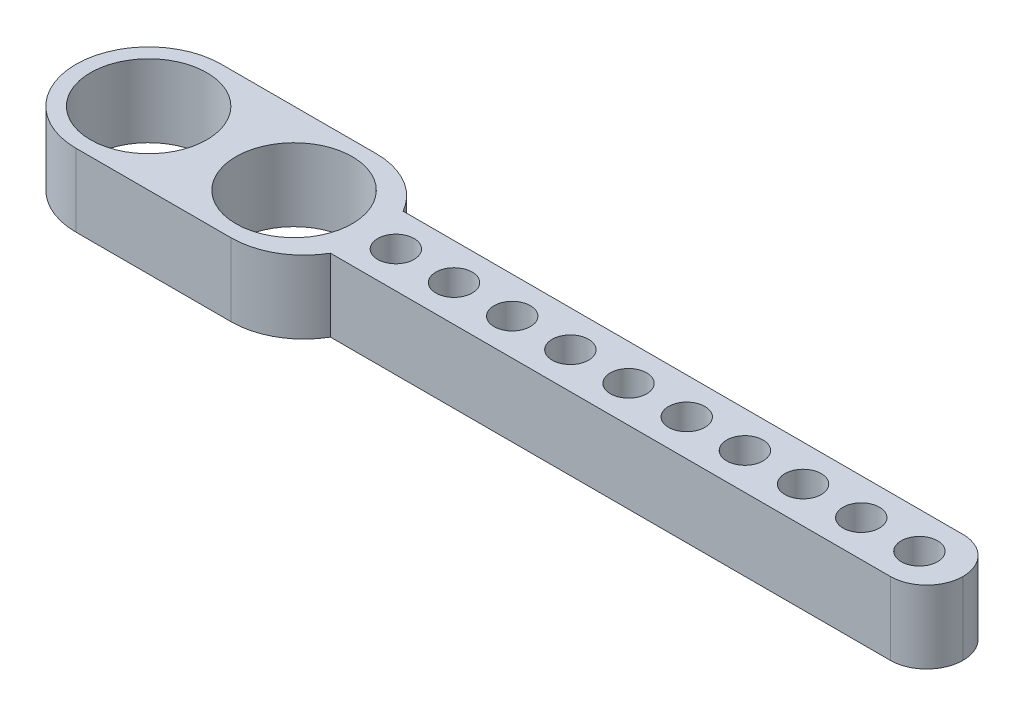
from build123d import *

# Parameters (mm, degrees)
SKETCH1_W           = 25.4
SKETCH1_H           = 12.7
SKETCH1_R           = 5.08
SKETCH1_W_2         = 52.07
SKETCH1_H_2         = 6.35
SKETCH1_R_2         = 1.5875
BOSS_EXTRUDE1_DEPTH = 6.35
FILLET1_R           = 6.35
FILLET2_R           = 3.175


# Some blends are built 0.0001 mm under size
with BuildPart() as part:
    # Sketch1 → Boss-Extrude1 (new body)
    # profile 1 of 2: a face of its own
    with BuildSketch(Plane(origin=(0, 0, 0), x_dir=(1, 0, 0), z_dir=(0, 1, 0))):
        with Locations((12.7, 6.35)):
            Rectangle(SKETCH1_W, SKETCH1_H)
        with Locations(Location((19.05, 6.35, 0), (0, 0, 270))):
            Circle(SKETCH1_R, mode=Mode.SUBTRACT)
        with Locations(Location((6.35, 6.35, 0), (0, 0, 270))):
            Circle(SKETCH1_R, mode=Mode.SUBTRACT)
    # profile 2 of 2: a face of its own
    with BuildSketch(Plane(origin=(0, 0, 0), x_dir=(1, 0, 0), z_dir=(0, 1, 0))):
        with Locations((51.435, 6.35)):
            Rectangle(SKETCH1_W_2, SKETCH1_H_2)
        with Locations(Location((27.94, 6.35, 0), (0, 0, 270))):
            Circle(SKETCH1_R_2, mode=Mode.SUBTRACT)
        with Locations(Location((33.02, 6.35, 0), (0, 0, 270))):
            Circle(SKETCH1_R_2, mode=Mode.SUBTRACT)
        with Locations(Location((38.1, 6.35, 0), (0, 0, 270))):
            Circle(SKETCH1_R_2, mode=Mode.SUBTRACT)
        with Locations(Location((43.18, 6.35, 0), (0, 0, 270))):
            Circle(SKETCH1_R_2, mode=Mode.SUBTRACT)
        with Locations(Location((48.26, 6.35, 0), (0, 0, 270))):
            Circle(SKETCH1_R_2, mode=Mode.SUBTRACT)
        with Locations(Location((53.34, 6.35, 0), (0, 0, 270))):
            Circle(SKETCH1_R_2, mode=Mode.SUBTRACT)
        with Locations(Location((58.42, 6.35, 0), (0, 0, 270))):
            Circle(SKETCH1_R_2, mode=Mode.SUBTRACT)
        with Locations(Location((63.5, 6.35, 0), (0, 0, 270))):
            Circle(SKETCH1_R_2, mode=Mode.SUBTRACT)
        with Locations(Location((68.58, 6.35, 0), (0, 0, 270))):
            Circle(SKETCH1_R_2, mode=Mode.SUBTRACT)
        with Locations(Location((73.66, 6.35, 0), (0, 0, 270))):
            Circle(SKETCH1_R_2, mode=Mode.SUBTRACT)
    extrude(amount=BOSS_EXTRUDE1_DEPTH)

    # Fillet1
    # the kernel refuses this fillet: 6.35 mm, written as the material it takes off along each edge
    with BuildSketch(Plane(origin=(25.4, -13.748153285, -12.7), x_dir=(-1, 0, 0), z_dir=(0, 1, 0))) as fillet1_piece_1:
        with BuildLine():
            CenterArc((5.499261314, 6.35), FILLET1_R, 210, 60)
            Line((0, 3.175), (-0.109985226, 3.1115))
            ThreePointArc((-0.109985226, 3.1115), (-0.127, 1.5875), (-0.127, 0))
            Line((-0.127, 0), (0, -0.127))
            Line((0, -0.127), (5.499261314, -0.127))
            Line((5.499261314, -0.127), (5.499261314, 0))
        make_face()
    extrude(amount=33.84630657, mode=Mode.SUBTRACT)
    with BuildSketch(Plane(origin=(25.4, -13.748153285, 0), x_dir=(-1, 0, 0), z_dir=(0, 1, 0))) as fillet1_piece_2:
        with BuildLine():
            CenterArc((5.499261314, -6.35), FILLET1_R, 90, 60)
            Line((0, -3.175), (-0.109985226, -3.1115))
            ThreePointArc((-0.109985226, -3.1115), (-0.127, -1.5875), (-0.127, 0))
            Line((-0.127, 0), (0, 0.127))
            Line((0, 0.127), (5.499261314, 0.127))
            Line((5.499261314, 0.127), (5.499261314, 0))
        make_face()
    extrude(amount=33.84630657, mode=Mode.SUBTRACT)
    with BuildSketch(Plane(origin=(0, -15.875, -12.7), x_dir=(0, 0, 1), z_dir=(0, 1, 0)), Plane(origin=(0, -15.875, 0), x_dir=(1, 0, 0), z_dir=(0, 1, 0))) as fillet1_piece_3:
        with BuildLine():
            CenterArc((FILLET1_R, FILLET1_R), FILLET1_R, 180, 90)
            Line((0, FILLET1_R), (-FILLET1_R * 0.02, FILLET1_R))
            Line((-FILLET1_R * 0.02, FILLET1_R), (-FILLET1_R * 0.02, -FILLET1_R * 0.02))
            Line((-FILLET1_R * 0.02, -FILLET1_R * 0.02), (FILLET1_R, -FILLET1_R * 0.02))
            Line((FILLET1_R, -FILLET1_R * 0.02), (FILLET1_R, 0))
        make_face()
    extrude(amount=38.1, mode=Mode.SUBTRACT)

    # Fillet2
    fillet2_edges = [part.edges().sort_by_distance(p)[0] for p in [
        (77.47, 3.175, -9.525),
        (77.47, 3.175, -3.175),
    ]]
    fillet(fillet2_edges, radius=FILLET2_R - 0.0001)  # a hair under: the kernel refuses the full size


solid = part.part
